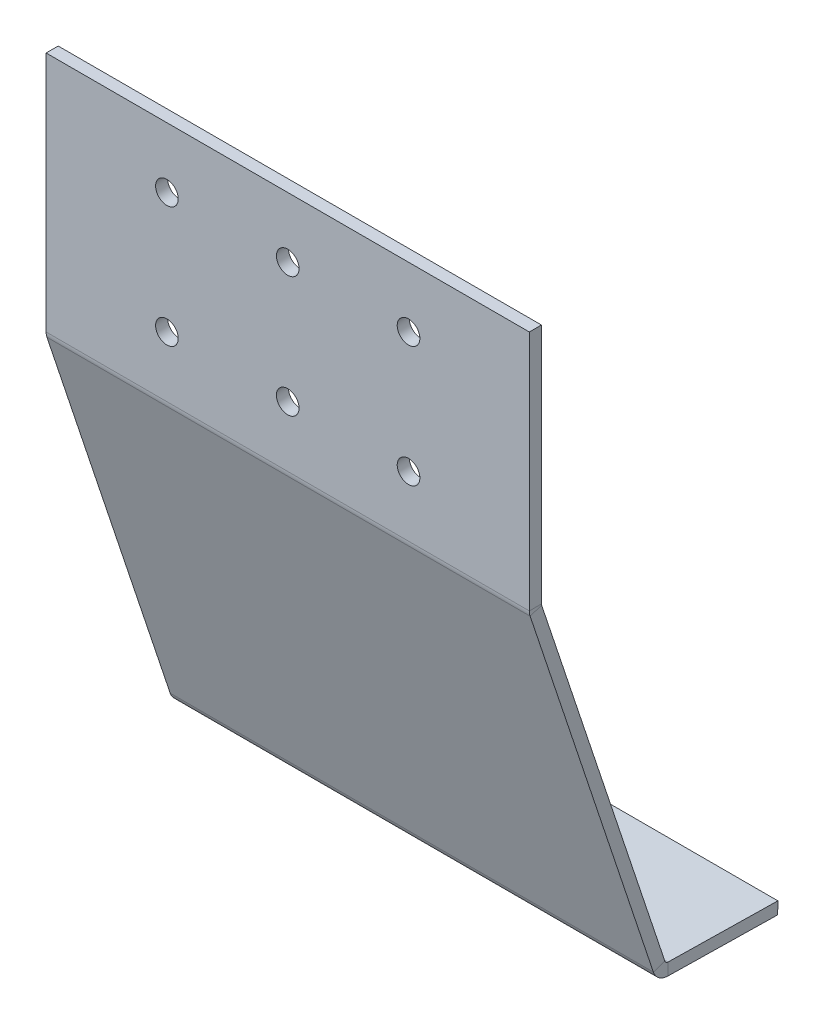
from build123d import *

# Parameters (mm, degrees)
SKETCH1_W            = 101.6
SKETCH1_H            = 50.8
BASE_FLANGE1_DEPTH   = 2.54
EDGE_FLANGE1_DEPTH   = 101.6
EDGE_FLANGE2_START   = -50.8
EDGE_FLANGE2_DEPTH   = 101.6
EDGE_FLANGE2_2_DEPTH = 101.6
SKETCH12_R           = 2.38125
CUT_EXTRUDE1_DEPTH   = 130.341409222


# Read off the part's stored shape, not the designer's step: Edge-Flange2
# Sheet-metal steps are written as plain solids
with BuildPart() as part:
    # Sketch1 → Base-Flange1 (new body)
    with BuildSketch(Plane.XY):
        Rectangle(SKETCH1_W, SKETCH1_H)
    extrude(amount=-BASE_FLANGE1_DEPTH)

    # Edge-Flange1 section (across the edge) → Edge-Flange1 (add)
    with BuildSketch(Plane(origin=(50.8, -25.519501076, -2.54), x_dir=(0, 0.3161458239738, -0.9487106081329159), z_dir=(-1, 0, 0))):
        with BuildLine():
            Line((-2.54, 0.119501076), (-2.54, 85.312927325))
            Line((-2.54, 85.312927325), (0, 85.312927325))
            Line((0, 85.312927325), (0, 0.119501076))
            ThreePointArc((0, 0.119501076), (0.009506284, 0.001542236), (0.037779766, -0.113371938))
            Line((0.037779766, -0.113371938), (-2.371945179, -0.916382331))
            ThreePointArc((-2.371945179, -0.916382331), (-2.497713427, -0.405212383), (-2.54, 0.119501076))
        make_face()
    extrude(amount=EDGE_FLANGE1_DEPTH)

    # Edge-Flange2 outline → Edge-Flange2 (cut)
    with BuildSketch(Plane.YZ.offset(EDGE_FLANGE2_START)):
        with BuildLine():
            Line((-106.45678024, -29.511325705), (-106.45024051, -29.136664838))
            ThreePointArc((-106.45024051, -29.136664838), (-105.815351907, -27.254750412), (-104.210022959, -26.085304214))
            Line((-104.210022959, -26.085304214), (-107.259790633, -27.10160076))
            Line((-107.259790633, -27.10160076), (-106.45678024, -29.511325705))
        make_face()
    extrude(amount=EDGE_FLANGE2_DEPTH, mode=Mode.SUBTRACT)

    # Edge-Flange2 2 outline → Edge-Flange2 2 (add)
    with BuildSketch(Plane.YZ.offset(EDGE_FLANGE2_START)):
        with BuildLine():
            Line((-103.407012566, -28.495029159), (-106.45678024, -29.511325705))
            Line((-106.45678024, -29.511325705), (-106.853065184, -52.214474934))
            Line((-106.853065184, -52.214474934), (-104.313452038, -52.258804046))
            Line((-104.313452038, -52.258804046), (-103.910627364, -29.18099395))
            ThreePointArc((-103.910627364, -29.18099395), (-103.767900469, -28.757927917), (-103.407012566, -28.495029159))
        make_face()
    extrude(amount=EDGE_FLANGE2_2_DEPTH)

    # Sketch12 → Cut-Extrude1 (cut, through all)
    with BuildSketch(Plane.XY):
        with Locations((-25.4, 12.7)):
            Circle(SKETCH12_R)
        with Locations((0, 12.7)):
            Circle(SKETCH12_R)
        with Locations((25.4, 12.7)):
            Circle(SKETCH12_R)
        with Locations((25.4, -12.7)):
            Circle(SKETCH12_R)
        with Locations((0, -12.7)):
            Circle(SKETCH12_R)
        with Locations((-25.4, -12.7)):
            Circle(SKETCH12_R)
    extrude(amount=-CUT_EXTRUDE1_DEPTH, mode=Mode.SUBTRACT)


solid = part.part
